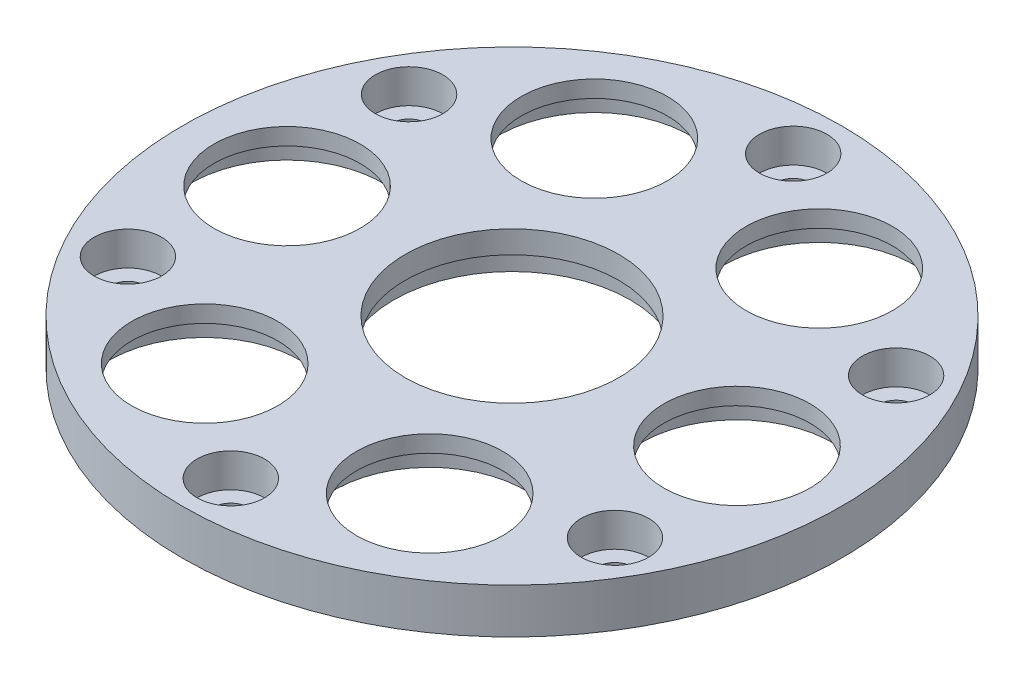
from build123d import *

# Parameters (mm, degrees)
SKETCH1_R           = 29.3
BOSS_EXTRUDE1_DEPTH = 4
SKETCH1_4_R         = 9.5
SKETCH1_4_R_2       = 6.5
SKETCH1_4_R_3       = 1.55
CUT_EXTRUDE1_DEPTH  = 42.629076377
CUT_EXTRUDE2_START  = -1.5
SKETCH1_5_R         = 8.5
SKETCH1_5_R_2       = 6.5
CUT_EXTRUDE2_DEPTH  = 41.129076377
CUT_EXTRUDE3_START  = -2
SKETCH1_6_R         = 10.5
SKETCH1_6_R_2       = 9.5
CUT_EXTRUDE3_DEPTH  = 40.629076377
SKETCH1_7_R         = 3
SKETCH1_7_R_2       = 1.55
CUT_EXTRUDE4_DEPTH  = 3


with BuildPart() as part:
    # Sketch1 → Boss-Extrude1 (new body)
    with BuildSketch(Plane(origin=(0, 0, 0), x_dir=(1, 0, 0), z_dir=(0, 1, 0))):
        Circle(SKETCH1_R)
    extrude(amount=-BOSS_EXTRUDE1_DEPTH)

    # Sketch1<4> → Cut-Extrude1 (cut, through all)
    with BuildSketch(Plane(origin=(0, 0, 0), x_dir=(1, 0, 0), z_dir=(0, 1, 0))):
        Circle(SKETCH1_4_R)
        with Locations((-20, 0)):
            Circle(SKETCH1_4_R_2)
        with Locations((-10, 17.320508076)):
            Circle(SKETCH1_4_R_2)
        with Locations((10, 17.320508076)):
            Circle(SKETCH1_4_R_2)
        with Locations((20, 0)):
            Circle(SKETCH1_4_R_2)
        with Locations((10, -17.320508076)):
            Circle(SKETCH1_4_R_2)
        with Locations((-10, -17.320508076)):
            Circle(SKETCH1_4_R_2)
        with Locations((0, 25)):
            Circle(SKETCH1_4_R_3)
        with Locations((21.650635095, 12.5)):
            Circle(SKETCH1_4_R_3)
        with Locations((21.650635095, -12.5)):
            Circle(SKETCH1_4_R_3)
        with Locations((0, -25)):
            Circle(SKETCH1_4_R_3)
        with Locations((-21.650635095, -12.5)):
            Circle(SKETCH1_4_R_3)
        with Locations((-21.650635095, 12.5)):
            Circle(SKETCH1_4_R_3)
    extrude(amount=-CUT_EXTRUDE1_DEPTH, mode=Mode.SUBTRACT)

    # Sketch1<5> → Cut-Extrude2 (cut, through all)
    # profile 1 of 6: a face of its own
    with BuildSketch(Plane(origin=(0, 0, 0), x_dir=(1, 0, 0), z_dir=(0, 1, 0)).offset(CUT_EXTRUDE2_START)):
        with Locations((-20, 0)):
            Circle(SKETCH1_5_R)
        with Locations((-20, 0)):
            Circle(SKETCH1_5_R_2, mode=Mode.SUBTRACT)
    # profile 2 of 6: a face of its own
    with BuildSketch(Plane(origin=(0, 0, 0), x_dir=(1, 0, 0), z_dir=(0, 1, 0)).offset(CUT_EXTRUDE2_START)):
        with Locations((-10, 17.320508076)):
            Circle(SKETCH1_5_R)
        with Locations((-10, 17.320508076)):
            Circle(SKETCH1_5_R_2, mode=Mode.SUBTRACT)
    # profile 3 of 6: a face of its own
    with BuildSketch(Plane(origin=(0, 0, 0), x_dir=(1, 0, 0), z_dir=(0, 1, 0)).offset(CUT_EXTRUDE2_START)):
        with Locations((10, 17.320508076)):
            Circle(SKETCH1_5_R)
        with Locations((10, 17.320508076)):
            Circle(SKETCH1_5_R_2, mode=Mode.SUBTRACT)
    # profile 4 of 6: a face of its own
    with BuildSketch(Plane(origin=(0, 0, 0), x_dir=(1, 0, 0), z_dir=(0, 1, 0)).offset(CUT_EXTRUDE2_START)):
        with Locations((20, 0)):
            Circle(SKETCH1_5_R)
        with Locations((20, 0)):
            Circle(SKETCH1_5_R_2, mode=Mode.SUBTRACT)
    # profile 5 of 6: a face of its own
    with BuildSketch(Plane(origin=(0, 0, 0), x_dir=(1, 0, 0), z_dir=(0, 1, 0)).offset(CUT_EXTRUDE2_START)):
        with Locations((10, -17.320508076)):
            Circle(SKETCH1_5_R)
        with Locations((10, -17.320508076)):
            Circle(SKETCH1_5_R_2, mode=Mode.SUBTRACT)
    # profile 6 of 6: a face of its own
    with BuildSketch(Plane(origin=(0, 0, 0), x_dir=(1, 0, 0), z_dir=(0, 1, 0)).offset(CUT_EXTRUDE2_START)):
        with Locations((-10, -17.320508076)):
            Circle(SKETCH1_5_R)
        with Locations((-10, -17.320508076)):
            Circle(SKETCH1_5_R_2, mode=Mode.SUBTRACT)
    extrude(amount=-CUT_EXTRUDE2_DEPTH, mode=Mode.SUBTRACT)

    # Sketch1<6> → Cut-Extrude3 (cut, through all)
    with BuildSketch(Plane(origin=(0, 0, 0), x_dir=(1, 0, 0), z_dir=(0, 1, 0)).offset(CUT_EXTRUDE3_START)):
        Circle(SKETCH1_6_R)
        Circle(SKETCH1_6_R_2, mode=Mode.SUBTRACT)
    extrude(amount=-CUT_EXTRUDE3_DEPTH, mode=Mode.SUBTRACT)

    # Sketch1<7> → Cut-Extrude4 (cut)
    # profile 1 of 6: a face of its own
    with BuildSketch(Plane(origin=(0, 0, 0), x_dir=(1, 0, 0), z_dir=(0, 1, 0))):
        with Locations((0, 25)):
            Circle(SKETCH1_7_R)
        with Locations((0, 25)):
            Circle(SKETCH1_7_R_2, mode=Mode.SUBTRACT)
    # profile 2 of 6: a face of its own
    with BuildSketch(Plane(origin=(0, 0, 0), x_dir=(1, 0, 0), z_dir=(0, 1, 0))):
        with Locations((21.650635095, 12.5)):
            Circle(SKETCH1_7_R)
        with Locations((21.650635095, 12.5)):
            Circle(SKETCH1_7_R_2, mode=Mode.SUBTRACT)
    # profile 3 of 6: a face of its own
    with BuildSketch(Plane(origin=(0, 0, 0), x_dir=(1, 0, 0), z_dir=(0, 1, 0))):
        with Locations((21.650635095, -12.5)):
            Circle(SKETCH1_7_R)
        with Locations((21.650635095, -12.5)):
            Circle(SKETCH1_7_R_2, mode=Mode.SUBTRACT)
    # profile 4 of 6: a face of its own
    with BuildSketch(Plane(origin=(0, 0, 0), x_dir=(1, 0, 0), z_dir=(0, 1, 0))):
        with Locations((0, -25)):
            Circle(SKETCH1_7_R)
        with Locations((0, -25)):
            Circle(SKETCH1_7_R_2, mode=Mode.SUBTRACT)
    # profile 5 of 6: a face of its own
    with BuildSketch(Plane(origin=(0, 0, 0), x_dir=(1, 0, 0), z_dir=(0, 1, 0))):
        with Locations((-21.650635095, -12.5)):
            Circle(SKETCH1_7_R)
        with Locations((-21.650635095, -12.5)):
            Circle(SKETCH1_7_R_2, mode=Mode.SUBTRACT)
    # profile 6 of 6: a face of its own
    with BuildSketch(Plane(origin=(0, 0, 0), x_dir=(1, 0, 0), z_dir=(0, 1, 0))):
        with Locations((-21.650635095, 12.5)):
            Circle(SKETCH1_7_R)
        with Locations((-21.650635095, 12.5)):
            Circle(SKETCH1_7_R_2, mode=Mode.SUBTRACT)
    extrude(amount=-CUT_EXTRUDE4_DEPTH, mode=Mode.SUBTRACT)


solid = part.part
